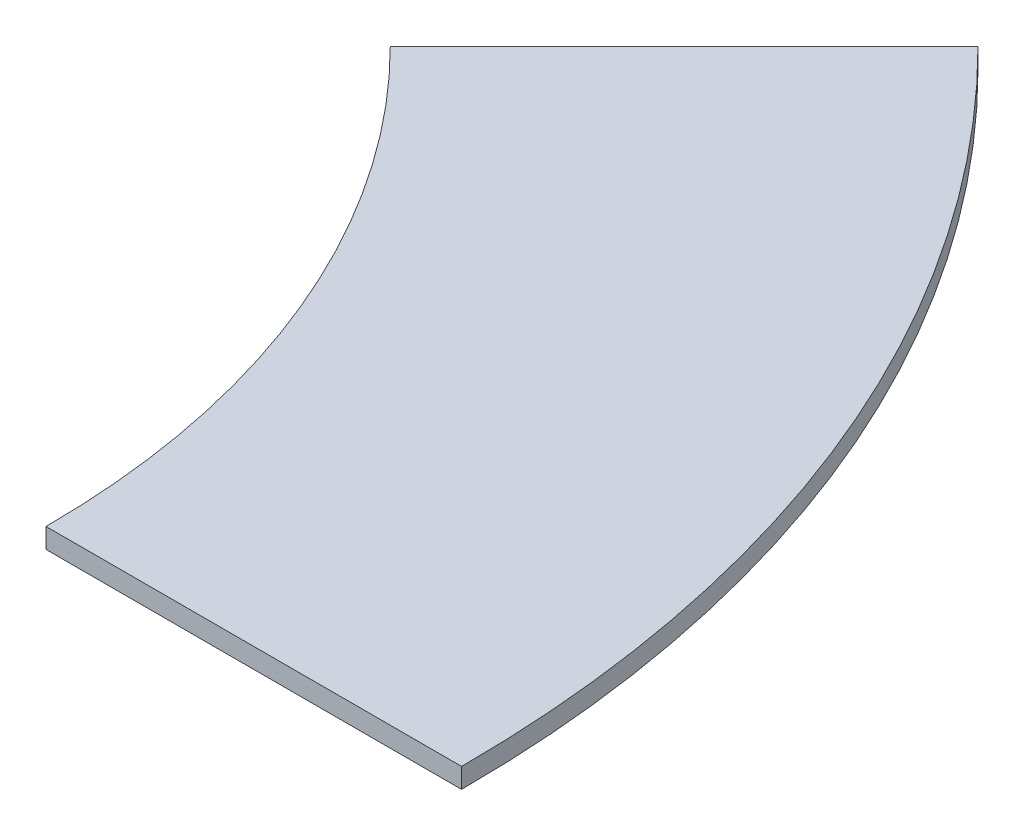
from build123d import *

# Parameters (mm, degrees)
SKETCH2_W      = 500
SKETCH2_H      = 24
REVOLVE1_ANGLE = 45


with BuildPart() as part:
    # Sketch2 → Revolve1 (revolve)
    with BuildSketch(Plane.XY):
        with Locations((1250, 0)):
            Rectangle(SKETCH2_W, SKETCH2_H)
    revolve(axis=Axis((0, 0, 0), (0, 1, 0)), revolution_arc=REVOLVE1_ANGLE)


solid = part.part
